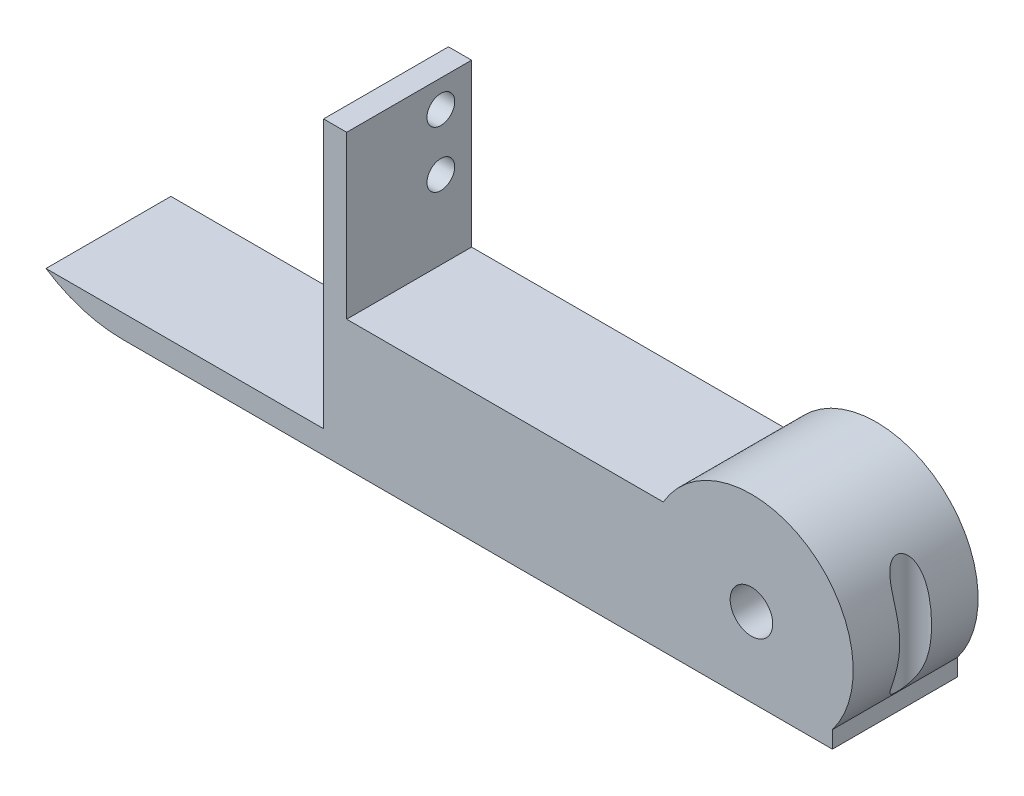
from build123d import *

# Parameters (mm, degrees)
RESSALTO_EXTRUS_O2_DEPTH = 27
ESBO_O2_R                = 4.6
CORTE_EXTRUS_O1_DEPTH    = 35
CORTE_EXTRUS_O3_DEPTH    = 60
ESBO_O7_W                = 27
ESBO_O7_H                = 35
RESSALTO_EXTRUS_O3_DEPTH = 5
ESBO_O8_R                = 3
CORTE_EXTRUS_O4_DEPTH    = 123.96442575
FILETE1_R                = 30
ESBO_O12_R               = 3.5
CORTE_EXTRUS_O5_DEPTH    = 113.730874209


with BuildPart() as part:
    # Esboço1 → Ressalto-extrusão2 (new body)
    with BuildSketch(Plane.XY):
        with BuildLine():
            Line((-85, -14), (85, -14))
            Line((85, -14), (85, -10.332291626))
            ThreePointArc((85, -10.332291626), (79.690886502, 21.313445506), (48.447441117, 14))
            Line((48.447441117, 14), (-85, 14))
            Line((-85, 14), (-85, -14))
        make_face()
    extrude(amount=RESSALTO_EXTRUS_O2_DEPTH)

    # Esboço2 → Corte-extrusão1 (cut)
    with BuildSketch(Plane.XY.offset(27)):
        with Locations((67.5, 3)):
            Circle(ESBO_O2_R)
    extrude(amount=-CORTE_EXTRUS_O1_DEPTH, mode=Mode.SUBTRACT)

    # Esboço6 → Corte-extrusão3 (cut)
    with BuildSketch(Plane.ZY.offset(85)):
        Polygon((5, -9), (22, -9), (27, -9), (27, 14), (0, 14), (0, -9), align=None)
    extrude(amount=-CORTE_EXTRUS_O3_DEPTH, mode=Mode.SUBTRACT)

    # Esboço7 → Ressalto-extrusão3 (add)
    with BuildSketch(Plane.ZY.offset(25)):
        with Locations((13.5, 31.5)):
            Rectangle(ESBO_O7_W, ESBO_O7_H)
    extrude(amount=-RESSALTO_EXTRUS_O3_DEPTH)

    # Esboço8 → Corte-extrusão4 (cut, through all)
    with BuildSketch(Plane(origin=(-20, 0, 0), x_dir=(0, 0, -1), z_dir=(1, 0, 0))):
        with Locations((-6.646583991, 43.091925341)):
            Circle(ESBO_O8_R)
        with Locations(Location((-6.646583991, 30.908074659, 0), (0, 0, 180))):
            Circle(ESBO_O8_R)
    extrude(amount=-CORTE_EXTRUS_O4_DEPTH, mode=Mode.SUBTRACT)

    # Filete1
    # the kernel refuses this fillet: 30 mm, written as the material it takes off along each edge
    with BuildSketch(Plane(origin=(-85, -14, -41.457809879), x_dir=(0, 1, 0), z_dir=(0, 0, 1))) as filete1_piece_1:
        with BuildLine():
            CenterArc((30, -16.583123952), FILETE1_R, 146.442690238, 33.557309762)
            Line((0, -16.583123952), (-0.6, -16.583123952))
            Line((-0.6, -16.583123952), (-0.6, 0))
            Line((-0.6, 0), (0, 0.6))
            ThreePointArc((0, 0.6), (2.5, 0.6), (4.5, 0.331662479))
            Line((4.5, 0.331662479), (5, 0))
        make_face()
    extrude(amount=109.915619759, mode=Mode.SUBTRACT)

    # Esboço12 → Corte-extrusão5 (cut, through all)
    with BuildSketch(Plane.XZ.offset(14)):
        with Locations((88.855428665, 13.5)):
            Circle(ESBO_O12_R)
    extrude(amount=-CORTE_EXTRUS_O5_DEPTH, mode=Mode.SUBTRACT)


solid = part.part
